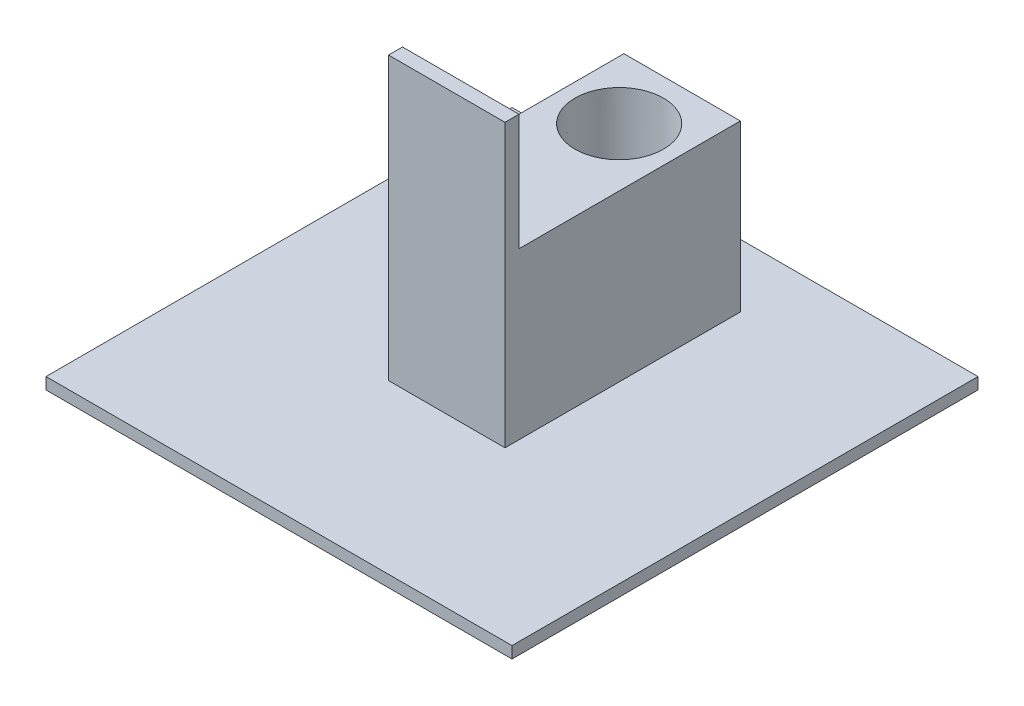
from build123d import *

# Parameters (mm, degrees)
SKETCH1_W              = 100
SKETCH1_H              = 100
BOSS_EXTRUDE1_DEPTH    = 38
SKETCH3_R              = 3
BOSS_EXTRUDE2_DEPTH    = 3
SKETCH4_R              = 8.25
SKETCH5_R              = 9.5
SKETCH6_W              = 25
SKETCH6_H              = 3
BOSS_EXTRUDE3_DEPTH    = 25
SKETCH9_W              = 25
SKETCH9_H              = 50.508544027
CUT_EXTRUDE3_DEPTH     = 35.5
SPLIT2_SURFACE_1_BACK  = 157.064
SPLIT2_SURFACE_1_DEPTH = 314.128
SPLIT2_SURFACE_2_BACK  = 157.064
SPLIT2_SURFACE_2_DEPTH = 314.128


with BuildPart() as part:
    # Sketch1 → Boss-Extrude1 (new body)
    with BuildSketch(Plane(origin=(0, 0, 0), x_dir=(1, 0, 0), z_dir=(0, 1, 0))):
        with Locations((1.25, -24.285714286)):
            Rectangle(SKETCH1_W, SKETCH1_H)
    extrude(amount=BOSS_EXTRUDE1_DEPTH)

    # Sketch3 → Boss-Extrude2 (add)
    with BuildSketch(Plane.XZ):
        with Locations((-27.034271247, 52.569985533)):
            Circle(SKETCH3_R)
        with Locations((29.534271247, 52.569985533)):
            Circle(SKETCH3_R)
        with Locations((29.534271247, -3.998556962)):
            Circle(SKETCH3_R)
        with Locations((-27.034271247, -3.998556962)):
            Circle(SKETCH3_R)
    extrude(amount=BOSS_EXTRUDE2_DEPTH)

    # Sketch4 → Cut-Loft1 section 0
    with BuildSketch(Plane.XZ):
        with Locations((1.25, 1.285714286)):
            Circle(SKETCH4_R)
    # Sketch5 → Cut-Loft1 section 1
    with BuildSketch(Plane(origin=(0, 38, 0), x_dir=(1, 0, 0), z_dir=(0, 1, 0))):
        with Locations((1.25, -1.285714286)):
            Circle(SKETCH5_R)
    loft(mode=Mode.SUBTRACT)

    # Sketch6 → Boss-Extrude3 (add)
    with BuildSketch(Plane(origin=(0, 38, 0), x_dir=(1, 0, 0), z_dir=(0, 1, 0))):
        with Locations((1.25, -36.785714286)):
            Rectangle(SKETCH6_W, SKETCH6_H)
    extrude(amount=BOSS_EXTRUDE3_DEPTH)

    # Sketch9 → Cut-Extrude3 (cut)
    with BuildSketch(Plane(origin=(0, 38, 0), x_dir=(1, 0, 0), z_dir=(0, 1, 0))):
        Polygon((-49.799740752, 27.751403127), (-11.25, 27.751403127), (13.75, 27.751403127), (53.406913463, 27.751403127), (53.406913463, -79.342393637), (26.184866917, -79.342393637), (26.184866917, -84.038284162), (-21.600270932, -84.038284162), (-21.600270932, -78.738481249), (-49.799740752, -78.738481249), align=None)
        with Locations((1.25, -13.031442273)):
            Rectangle(SKETCH9_W, SKETCH9_H, mode=Mode.SUBTRACT)
    extrude(amount=-CUT_EXTRUDE3_DEPTH, mode=Mode.SUBTRACT)


with BuildPart() as body_2:
    # Split2: the piece behind the surface
    add(part.part)
    # Split2 surface: a surface, the sketch's curves swept straight by 314.128 mm
    with BuildLine(Plane(origin=(0, 0, 0), x_dir=(0, 0, -1), z_dir=(1, 0, 0)).offset(-SPLIT2_SURFACE_1_BACK), mode=Mode.PRIVATE) as split2_surface_1_path:
        Line((-87.529688781, 2.5), (30.14596411, 2.5))
    split2_surface_1 = Shell.extrude(split2_surface_1_path.wire(), (1 * SPLIT2_SURFACE_1_DEPTH, 0 * SPLIT2_SURFACE_1_DEPTH, 0 * SPLIT2_SURFACE_1_DEPTH))
    split(bisect_by=split2_surface_1, keep=Keep.BOTTOM)


with BuildPart() as part_1:
    add(part.part)

    # Split2: split by a surface, the side it looks to stays
    # Split2 surface: a surface, the sketch's curves swept straight by 314.128 mm
    with BuildLine(Plane(origin=(0, 0, 0), x_dir=(0, 0, -1), z_dir=(1, 0, 0)).offset(-SPLIT2_SURFACE_2_BACK), mode=Mode.PRIVATE) as split2_surface_2_path:
        Line((-87.529688781, 2.5), (30.14596411, 2.5))
    split2_surface_2 = Shell.extrude(split2_surface_2_path.wire(), (1 * SPLIT2_SURFACE_2_DEPTH, 0 * SPLIT2_SURFACE_2_DEPTH, 0 * SPLIT2_SURFACE_2_DEPTH))
    split(bisect_by=split2_surface_2, keep=Keep.TOP)


solid = Compound([body_2.part, part_1.part])
